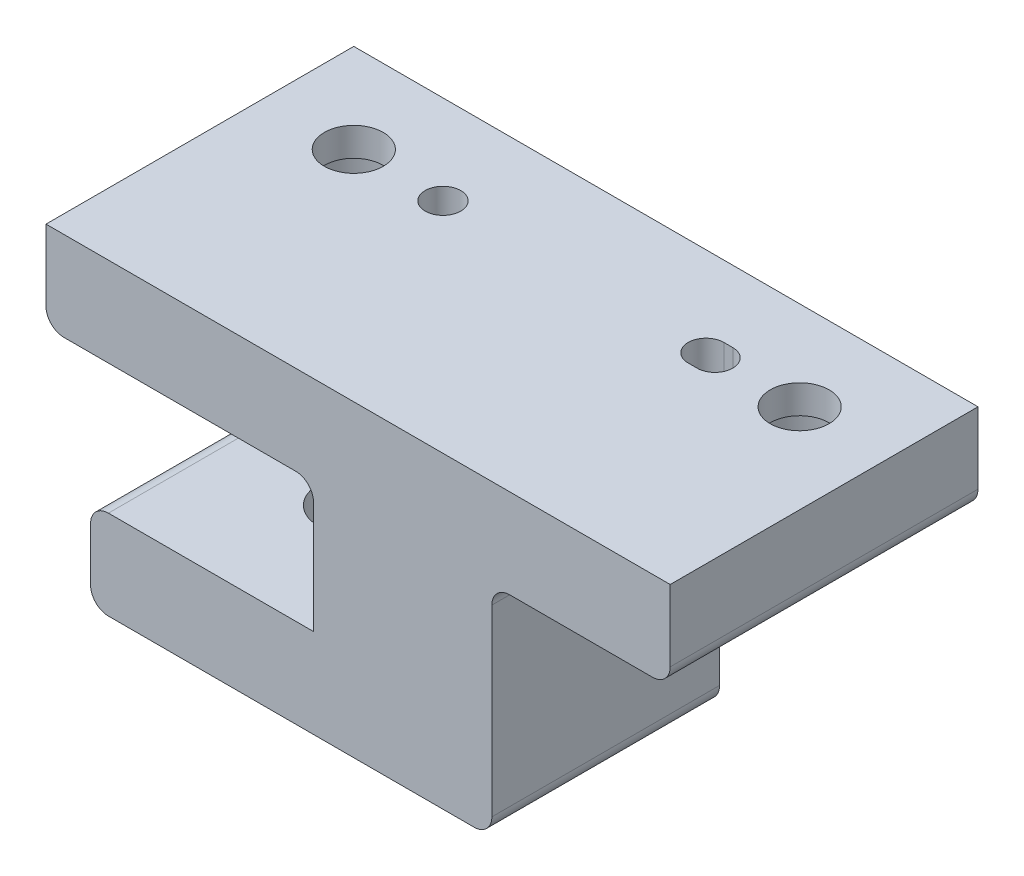
from build123d import *

# Parameters (mm, degrees)
SKETCH_8_W                = 70
SKETCH_8_H                = 30
EXTRUDE_3_DEPTH           = 34.57
SKETCH_9_W                = 30
SKETCH_9_H                = 14.57
SKETCH_9_W_2              = 20
CUT_EXTRUDE_3_DEPTH       = 67.664217758
OTHER_1_OUTLINE_R         = 5.5
OTHER_1_DEPTH             = 5
HOLE_WIZARD_2_D           = 4.5
HOLE_WIZARD_2_DEPTH       = 10
HOLE_WIZARD_2_CBORE_D     = 8
HOLE_WIZARD_2_CBORE_DEPTH = 4.6
BACK_REACH                = 69.458
SKETCH_16_W               = 70
SKETCH_16_H               = 8.975361008
MM_1_D                    = 4
MM_1_DEPTH                = 5
MM_1_TIP                  = 1.201721238
CUT_EXTRUDE_5_DEPTH       = 5
SKETCH_24_W               = 5
SKETCH_24_H               = 21.024638992
SKETCH_24_W_2             = 20
CUT_EXTRUDE_6_DEPTH       = 10
HOLE_WIZARD_3_D           = 6.6
HOLE_WIZARD_3_DEPTH       = 10
HOLE_WIZARD_3_CBORE_D     = 11
HOLE_WIZARD_3_CBORE_DEPTH = 6.8
FILLET_1_R                = 2
SKETCH_29_W               = 10
SKETCH_29_H               = 2
EXTRUDE_5_DEPTH           = 2.329281552
FILLET_3_R                = 2
CUT_EXTRUDE_7_DEPTH       = 0.5
EXTRUDE_START             = 5.016506594
EXTRUDE_6_DEPTH           = 5.016506594


# Read off the part's stored shape, not the designer's step: 孔1
with BuildPart() as part:
    # 草图8 → 凸台-拉伸3 (new body)
    with BuildSketch(Plane(origin=(0, 0, 0), x_dir=(1, 0, 0), z_dir=(0, 1, 0))):
        with Locations((13.466824006, -16.724598186)):
            Rectangle(SKETCH_8_W, SKETCH_8_H)
    extrude(amount=EXTRUDE_3_DEPTH)

    # 草图9 → 切除-拉伸3 (cut, through all)
    with BuildSketch(Plane.XY.offset(31.724598186)):
        with Locations((-6.533175994, 17.285)):
            Rectangle(SKETCH_9_W, SKETCH_9_H)
        with Locations((38.466824006, 17.285)):
            Rectangle(SKETCH_9_W_2, SKETCH_9_H)
    extrude(amount=-CUT_EXTRUDE_3_DEPTH, mode=Mode.SUBTRACT)

    # 孔1 outline → 孔1 (cut)
    with BuildSketch(Plane(origin=(0, 0, 0), x_dir=(1, 0, 0), z_dir=(0, 1, 0))):
        with Locations((-1.533175994, -21.724598186)):
            Circle(OTHER_1_OUTLINE_R)
    extrude(amount=OTHER_1_DEPTH, mode=Mode.SUBTRACT)

    # 打孔尺寸(%根据)内六角圆柱头螺钉的类型2
    with Locations(Plane(origin=(-1.533175994, 10, 21.724598186), x_dir=(1, 0, 0), z_dir=(0, 1, 0))):
        with Locations((0, 0)):
            CounterBoreHole(HOLE_WIZARD_2_D / 2, HOLE_WIZARD_2_CBORE_D / 2, HOLE_WIZARD_2_CBORE_DEPTH, depth=HOLE_WIZARD_2_DEPTH)

    # back: up to this face of the body (flat: up to its plane)
    back_end = Plane(part.part.faces().sort_by_distance((-6.533175994, 24.57, 16.724598186))[0])
    # 草图16 → back (cut, up to the picked face)
    with BuildSketch(Plane(origin=(0, 0, 0), x_dir=(1, 0, 0), z_dir=(0, 1, 0)), mode=Mode.PRIVATE) as back_sk1:
        with Locations((13.466824006, -6.21227869)):
            Rectangle(SKETCH_16_W, SKETCH_16_H)
    back_tool1 = split(extrude(back_sk1.sketch, amount=BACK_REACH, mode=Mode.PRIVATE), bisect_by=back_end, keep=Keep.BOTH, mode=Mode.PRIVATE)
    add(back_tool1.solids().sort_by(Axis((13.466824, 0, 6.212279), (0, 1, 0)))[0], mode=Mode.SUBTRACT)

    # 大小mm 暗销孔1
    with Locations(Plane(origin=(-1.533175994, 34.57, 11.724598186), x_dir=(0, 0, 1), z_dir=(0, 1, 0))):
        with Locations((0, 0)):
            Hole(MM_1_D / 2, depth=MM_1_DEPTH)
            with Locations((0, 0, -(MM_1_DEPTH + MM_1_TIP / 2))):  # 118° drill point
                Cone(0, MM_1_D / 2, MM_1_TIP, mode=Mode.SUBTRACT)

    # 草图23 → 切除-拉伸5 (cut)
    with BuildSketch(Plane.XZ.offset(-34.57)):
        with BuildLine():
            Line((28.966824006, 9.724598186), (27.966824006, 9.724598186))
            ThreePointArc((27.966824006, 9.724598186), (25.966824006, 11.724598186), (27.966824006, 13.724598186))
            Line((27.966824006, 13.724598186), (28.966824006, 13.724598186))
            ThreePointArc((28.966824006, 13.724598186), (30.966824006, 11.724598186), (28.966824006, 9.724598186))
        make_face()
    extrude(amount=CUT_EXTRUDE_5_DEPTH, mode=Mode.SUBTRACT)

    # 草图24 → 切除-拉伸6 (cut)
    with BuildSketch(Plane(origin=(0, 0, 0), x_dir=(1, 0, 0), z_dir=(0, 1, 0))):
        with Locations((-19.033175994, -21.21227869)):
            Rectangle(SKETCH_24_W, SKETCH_24_H)
        with Locations((38.466824006, -21.21227869)):
            Rectangle(SKETCH_24_W_2, SKETCH_24_H)
    extrude(amount=CUT_EXTRUDE_6_DEPTH, mode=Mode.SUBTRACT)

    # 打孔尺寸(%根据)内六角圆柱头螺钉的类型3
    with Locations(Plane(origin=(-11.533175994, 24.57, 11.724598186), x_dir=(0, 0, -1), z_dir=(0, -1, 0))):
        with Locations((0, 0), (0, 50)):
            CounterBoreHole(HOLE_WIZARD_3_D / 2, HOLE_WIZARD_3_CBORE_D / 2, HOLE_WIZARD_3_CBORE_DEPTH, depth=HOLE_WIZARD_3_DEPTH)

    # 圆角1
    fillet_1_edges = [part.edges().sort_by_distance(p)[0] for p in [
        (-16.533175994, 0, 21.21227869),
        (-16.533175994, 10, 21.21227869),
        (28.466824006, 0, 21.21227869),
        (-21.533175994, 24.57, 16.724598186),
        (48.466824006, 24.57, 16.724598186),
        (8.466824006, 24.57, 21.21227869),
        (28.466824006, 24.57, 21.21227869),
    ]]
    fillet(fillet_1_edges, radius=FILLET_1_R)

    # 草图29 → 凸台-拉伸5 (add)
    with BuildSketch(Plane(origin=(0, 0, 10.699959194), x_dir=(-1, 0, 0), z_dir=(0, 0, -1))):
        with Locations((0, -1)):
            Rectangle(SKETCH_29_W, SKETCH_29_H)
    extrude(amount=-EXTRUDE_5_DEPTH)

    # 圆角3
    fillet_3_edges = [part.edges().sort_by_distance(p)[0] for p in [
        (-5, -2, 11.86459997),
        (5, -2, 11.86459997),
    ]]
    fillet(fillet_3_edges, radius=FILLET_3_R - 0.0001)  # a hair under: the kernel refuses the full size

    # 草图30 → 切除-拉伸7 (cut)
    with BuildSketch(Plane.XY.offset(31.724598186)):
        with BuildLine():
            Line((-14.533175994, 0), (26.466824006, 0))
            ThreePointArc((26.466824006, 0), (27.881037569, 0.585786438), (28.466824006, 2))
            Line((28.466824006, 2), (28.466824006, 22.57))
            ThreePointArc((28.466824006, 22.57), (29.052610444, 23.984213562), (30.466824006, 24.57))
            Line((30.466824006, 24.57), (46.466824006, 24.57))
            ThreePointArc((46.466824006, 24.57), (47.881037569, 25.155786438), (48.466824006, 26.57))
            Line((48.466824006, 26.57), (48.466824006, 34.57))
            Line((48.466824006, 34.57), (-21.533175994, 34.57))
            Line((-21.533175994, 34.57), (-21.533175994, 26.57))
            ThreePointArc((-21.533175994, 26.57), (-20.947389556, 25.155786438), (-19.533175994, 24.57))
            Line((-19.533175994, 24.57), (6.466824006, 24.57))
            ThreePointArc((6.466824006, 24.57), (7.881037569, 23.984213562), (8.466824006, 22.57))
            Line((8.466824006, 22.57), (8.466824006, 10))
            Line((8.466824006, 10), (-14.533175994, 10))
            ThreePointArc((-14.533175994, 10), (-15.947389556, 9.414213562), (-16.533175994, 8))
            Line((-16.533175994, 8), (-16.533175994, 2))
            ThreePointArc((-16.533175994, 2), (-15.947389556, 0.585786438), (-14.533175994, 0))
        make_face()
    extrude(amount=-CUT_EXTRUDE_7_DEPTH, mode=Mode.SUBTRACT)

    # 草图31 → 凸台-拉伸6 (add)
    with BuildSketch(Plane.XY.offset(31.224598186).offset(EXTRUDE_START)):
        with BuildLine():
            Line((-14.533175994, 0), (26.466824006, 0))
            ThreePointArc((26.466824006, 0), (27.881037569, 0.585786438), (28.466824006, 2))
            Line((28.466824006, 2), (28.466824006, 22.57))
            ThreePointArc((28.466824006, 22.57), (29.052610444, 23.984213562), (30.466824006, 24.57))
            Line((30.466824006, 24.57), (46.466824006, 24.57))
            ThreePointArc((46.466824006, 24.57), (47.881037569, 25.155786438), (48.466824006, 26.57))
            Line((48.466824006, 26.57), (48.466824006, 34.57))
            Line((48.466824006, 34.57), (-21.533175994, 34.57))
            Line((-21.533175994, 34.57), (-21.533175994, 26.57))
            ThreePointArc((-21.533175994, 26.57), (-20.947389556, 25.155786438), (-19.533175994, 24.57))
            Line((-19.533175994, 24.57), (6.466824006, 24.57))
            ThreePointArc((6.466824006, 24.57), (7.881037569, 23.984213562), (8.466824006, 22.57))
            Line((8.466824006, 22.57), (8.466824006, 10))
            Line((8.466824006, 10), (-14.533175994, 10))
            ThreePointArc((-14.533175994, 10), (-15.947389556, 9.414213562), (-16.533175994, 8))
            Line((-16.533175994, 8), (-16.533175994, 2))
            ThreePointArc((-16.533175994, 2), (-15.947389556, 0.585786438), (-14.533175994, 0))
        make_face()
    extrude(amount=-EXTRUDE_6_DEPTH)


solid = part.part
